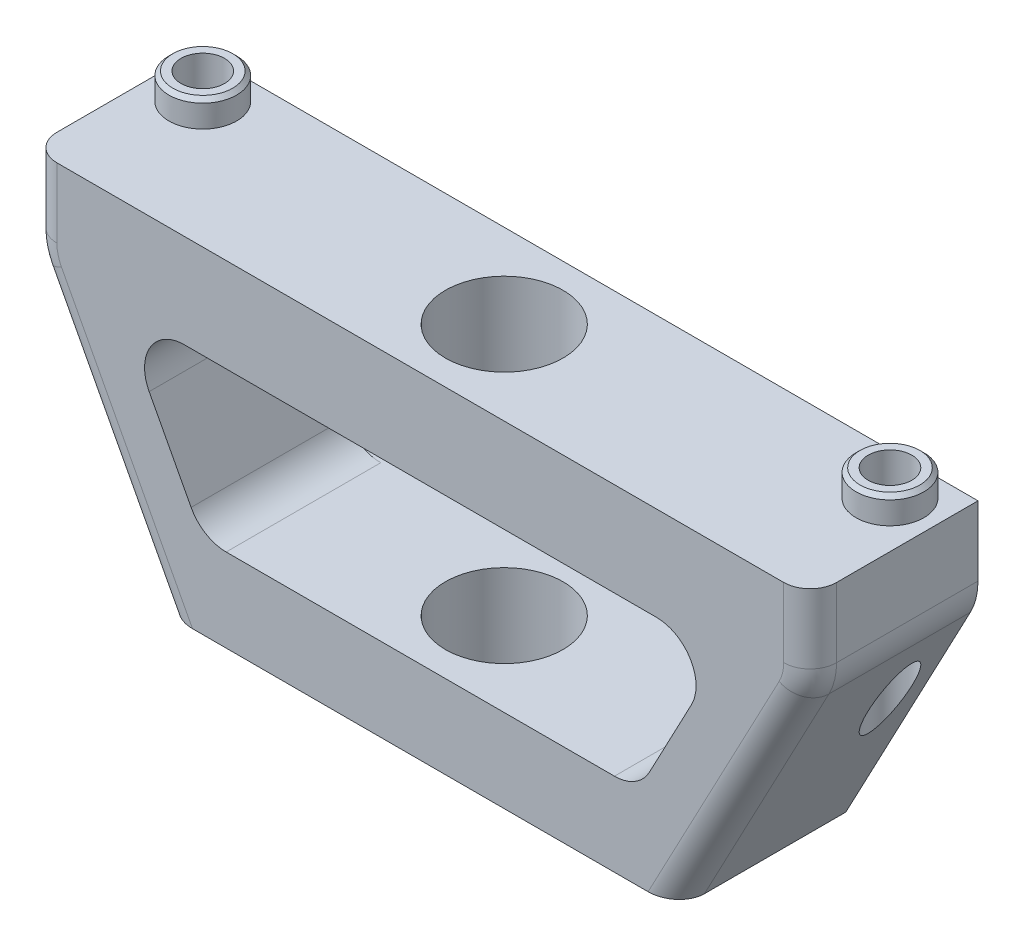
from build123d import *

# Parameters (mm, degrees)
BOSS_EXTRUDE1_DEPTH     = 6.35
CUT_EXTRUDE1_DEPTH      = 40.442775004
CUT_EXTRUDE1_DEPTH_BACK = 40.442775004
SKETCH3_R               = 4.45
CUT_EXTRUDE2_DEPTH      = 40.442775004
FILLET1_R               = 3
FILLET2_R               = 5
SKETCH4_R               = 2.565
SKETCH4_R_2             = 1.65
BOSS_EXTRUDE2_DEPTH     = 2
SKETCH5_R               = 1.65
CUT_EXTRUDE3_DEPTH      = 40.442775004
CUT_EXTRUDE4_DEPTH      = 1
FILLET3_R               = 2
CHAMFER1_SIZE           = 0.3


with BuildPart() as part:
    # Sketch1 → Boss-Extrude1 (new, symmetric)
    with BuildSketch(Plane.XY):
        Polygon((-29.5, 0), (29.5, 0), (29.5, -6.5), (19.5, -25.4), (-19.5, -25.4), (-29.5, -6.5), align=None)
    extrude(amount=BOSS_EXTRUDE1_DEPTH, both=True)

    # Sketch2 → Cut-Extrude1 (cut, two sides: drawn at the far end of the back side and taken through both)
    with BuildSketch(Plane.XY.offset(-CUT_EXTRUDE1_DEPTH_BACK)):
        Polygon((-22.846993177, -7.1), (-16.497786828, -19.1), (16.497786828, -19.1), (22.846993177, -7.1), align=None)
    extrude(amount=CUT_EXTRUDE1_DEPTH + CUT_EXTRUDE1_DEPTH_BACK, mode=Mode.SUBTRACT)

    # Sketch3 → Cut-Extrude2 (cut, through all)
    with BuildSketch(Plane(origin=(0, 0, 0), x_dir=(1, 0, 0), z_dir=(0, 1, 0))):
        Circle(SKETCH3_R)
    extrude(amount=-CUT_EXTRUDE2_DEPTH, mode=Mode.SUBTRACT)

    # Fillet1
    fillet1_edges = [part.edges().sort_by_distance(p)[0] for p in [
        (22.846993177, -7.1, 0),
        (16.497786828, -19.1, 0),
        (-22.846993177, -7.1, 0),
        (-16.497786828, -19.1, 0),
    ]]
    fillet(fillet1_edges, radius=FILLET1_R)

    # Fillet2
    fillet2_edges = [part.edges().sort_by_distance(p)[0] for p in [
        (29.5, -6.5, 0),
        (-29.5, -6.5, 0),
    ]]
    fillet(fillet2_edges, radius=FILLET2_R)

    # Sketch4 → Boss-Extrude2 (add)
    # profile 1 of 2: a face of its own
    with BuildSketch(Plane(origin=(0, 0, 0), x_dir=(1, 0, 0), z_dir=(0, 1, 0))):
        with Locations((-26, 3.19)):
            Circle(SKETCH4_R)
        with Locations((-26, 3.19)):
            Circle(SKETCH4_R_2, mode=Mode.SUBTRACT)
    # profile 2 of 2: a face of its own
    with BuildSketch(Plane(origin=(0, 0, 0), x_dir=(1, 0, 0), z_dir=(0, 1, 0))):
        with Locations((26, 3.19)):
            Circle(SKETCH4_R)
        with Locations((26, 3.19)):
            Circle(SKETCH4_R_2, mode=Mode.SUBTRACT)
    extrude(amount=BOSS_EXTRUDE2_DEPTH)

    # Sketch5 → Cut-Extrude3 (cut, through all)
    with BuildSketch(Plane(origin=(0, 0, 0), x_dir=(1, 0, 0), z_dir=(0, 1, 0))):
        with Locations((26, 3.19)):
            Circle(SKETCH5_R)
        with Locations((-26, 3.19)):
            Circle(SKETCH5_R)
    extrude(amount=-CUT_EXTRUDE3_DEPTH, mode=Mode.SUBTRACT)

    # Sketch6 → Cut-Extrude4 (cut)
    with BuildSketch(Plane(origin=(0, 0, -6.35), x_dir=(-1, 0, 0), z_dir=(0, 0, -1))):
        with BuildLine():
            Line((17.75, -19.1), (-17.75, -19.1))
            ThreePointArc((-17.75, -19.1), (-20.75, -16.1), (-17.75, -13.1))
            Line((-17.75, -13.1), (17.75, -13.1))
            ThreePointArc((17.75, -13.1), (20.75, -16.1), (17.75, -19.1))
        make_face()
    extrude(amount=-CUT_EXTRUDE4_DEPTH, mode=Mode.SUBTRACT)

    # Fillet3
    fillet3_edges = [part.edges().sort_by_distance(p)[0] for p in [
        (24.209754121, -16.498564711, 6.35),
        (29.352707554, -6.4634351, 6.35),
        (-24.209754121, -16.498564711, 6.35),
        (-29.352707554, -6.4634351, 6.35),
        (29.5, -2.629382636, 6.35),
        (-29.5, -2.629382636, 6.35),
    ]]
    fillet(fillet3_edges, radius=FILLET3_R)

    # Chamfer1
    chamfer1_edges = [part.edges().sort_by_distance(p)[0] for p in [
        (23.435, 2, -3.19),
        (-28.565, 2, -3.19),
    ]]
    chamfer(chamfer1_edges, length=CHAMFER1_SIZE)


solid = part.part
